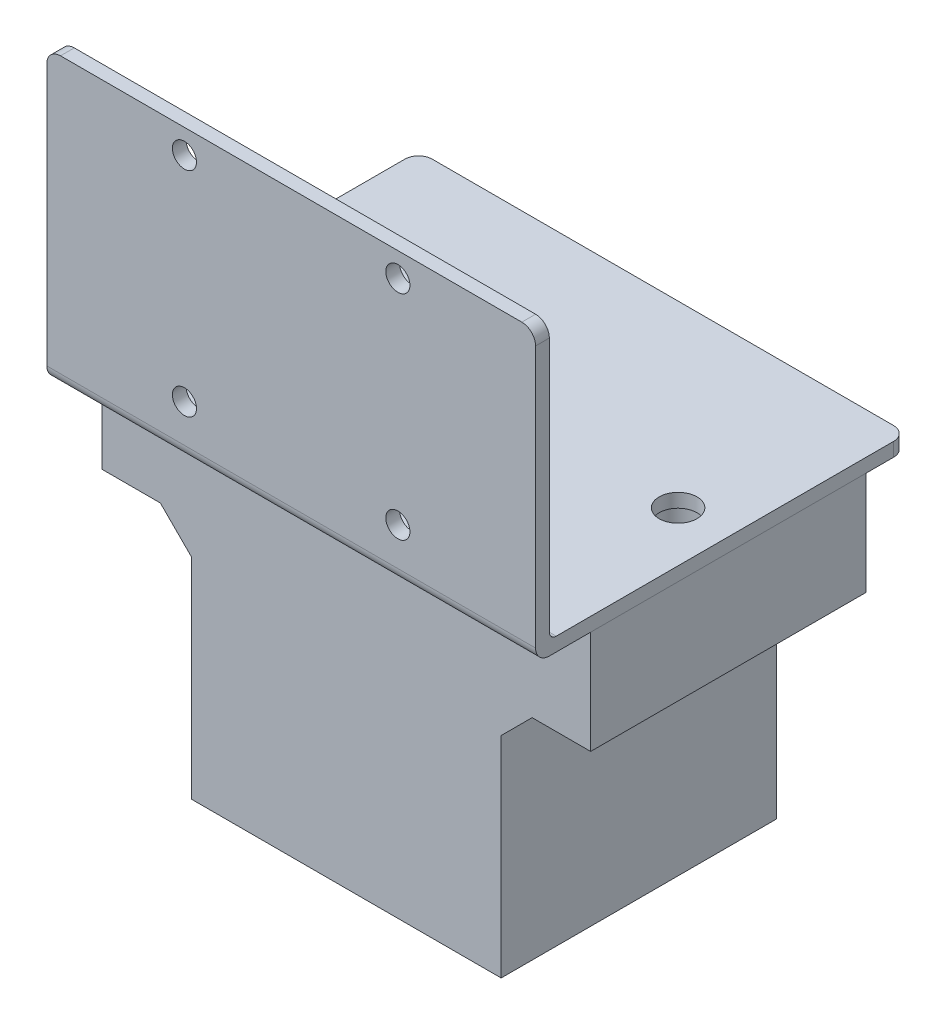
from build123d import *

# Parameters (mm, degrees)
RESSALTO_EXTRUS_O1_DEPTH   = 35.5
CORTE_EXTRUS_O1_DEPTH      = 77.001644719
CORTE_EXTRUS_O1_DEPTH_BACK = 77.001644719
ESBO_O2_R                  = 2.75
FILETE1_R                  = 2
FILETE2_R                  = 1
ESBO_O3_R                  = 1.75
CORTE_EXTRUS_O2_DEPTH      = 76.685203309
ESBO_O4_W                  = 71
ESBO_O4_H                  = 40
ESBO_O4_R                  = 3.25
RESSALTO_EXTRUS_O2_DEPTH   = 15
ESBO_O5_W                  = 45
ESBO_O5_H                  = 40
ESBO_O5_W_2                = 35.75
ESBO_O5_H_2                = 25.25
RESSALTO_EXTRUS_O3_DEPTH   = 35
CHANFRO1_SIZE              = 4.5


with BuildPart() as part:
    # Esboço1 → Ressalto-extrusão1 (new, symmetric)
    with BuildSketch(Plane(origin=(0, 0, 0), x_dir=(0, 0, -1), z_dir=(1, 0, 0))):
        Polygon((0, 0), (0, 42), (2, 42), (2, 2), (54, 2), (54, 0), align=None)
    extrude(amount=RESSALTO_EXTRUS_O1_DEPTH, both=True)

    # Esboço2 → Corte-extrusão1 (cut, two sides: drawn at the far end of the back side and taken through both)
    with BuildSketch(Plane(origin=(0, 2, 0), x_dir=(1, 0, 0), z_dir=(0, 1, 0)).offset(-CORTE_EXTRUS_O1_DEPTH_BACK)):
        with Locations(Location((-27.5, 28, 0), (0, 0, 270))):
            Circle(ESBO_O2_R)
        with Locations(Location((28.2, 28, 0), (0, 0, 270))):
            Circle(ESBO_O2_R)
    extrude(amount=CORTE_EXTRUS_O1_DEPTH + CORTE_EXTRUS_O1_DEPTH_BACK, mode=Mode.SUBTRACT)

    # Filete1
    filete1_edges = [part.edges().sort_by_distance(p)[0] for p in [
        (0, 0, 0),
        (35.5, 42, -1),
        (-35.5, 42, -1),
        (-35.5, 1, -54),
        (35.5, 1, -54),
    ]]
    fillet(filete1_edges, radius=FILETE1_R)

    # Filete2
    filete2_edges = [part.edges().sort_by_distance(p)[0] for p in [
        (0, 2, -2),
    ]]
    fillet(filete2_edges, radius=FILETE2_R)

    # Esboço3 → Corte-extrusão2 (cut, through all)
    with BuildSketch(Plane(origin=(0, 0, -2), x_dir=(-1, 0, 0), z_dir=(0, 0, -1))):
        with Locations(Location((-15.5, 38.5, 0), (0, 0, 90))):
            Circle(ESBO_O3_R)
        with Locations(Location((15.5, 38.5, 0), (0, 0, 90))):
            Circle(ESBO_O3_R)
        with Locations(Location((15.5, 7.5, 0), (0, 0, 90))):
            Circle(ESBO_O3_R)
        with Locations(Location((-15.5, 7.5, 0), (0, 0, 90))):
            Circle(ESBO_O3_R)
    extrude(amount=-CORTE_EXTRUS_O2_DEPTH, mode=Mode.SUBTRACT)


with BuildPart() as body_2:
    # Esboço4 → Ressalto-extrusão2 (new body)
    with BuildSketch(Plane.XZ):
        with Locations((0, -28)):
            Rectangle(ESBO_O4_W, ESBO_O4_H)
        with Locations(Location((-27.5, -28, 0), (0, 0, 270))):
            Circle(ESBO_O4_R, mode=Mode.SUBTRACT)
        with Locations(Location((28.2, -28, 0), (0, 0, 270))):
            Circle(ESBO_O4_R, mode=Mode.SUBTRACT)
    extrude(amount=RESSALTO_EXTRUS_O2_DEPTH)

    # Esboço5 → Ressalto-extrusão3 (add)
    with BuildSketch(Plane.XZ.offset(15)):
        with Locations((0, -28)):
            Rectangle(ESBO_O5_W, ESBO_O5_H)
        with Locations((0, -28)):
            Rectangle(ESBO_O5_W_2, ESBO_O5_H_2, mode=Mode.SUBTRACT)
    extrude(amount=RESSALTO_EXTRUS_O3_DEPTH)

    # Chanfro1
    # the kernel refuses this chamfer: 4.5 mm, written as the material it adds along each edge
    with BuildSketch(Plane(origin=(-22.5, -15, -48), x_dir=(-0.9996219169112966, 0.0274958766105864, 0), z_dir=(0, 0, 1))) as chanfro1_piece_1_section:
        Polygon((CHANFRO1_SIZE * 0.999621916911, CHANFRO1_SIZE * 0.0274958766106), (-CHANFRO1_SIZE * 0.0274958766106, CHANFRO1_SIZE * 0.999621916911), (0, 0), align=None)
    chanfro1_piece_1 = extrude(amount=40, mode=Mode.PRIVATE)
    chanfro1_piece_1 = chanfro1_piece_1 - Plane(origin=(-27.5, -16.515606652, -28), x_dir=(0, 0, -1), z_dir=(0, 1, 0)) * Cylinder(3.25, 98, mode=Mode.PRIVATE)
    add(chanfro1_piece_1)
    with BuildSketch(Plane(origin=(22.5, -15, -8), x_dir=(0.9996219169112966, 0.0274958766105864, 0), z_dir=(0, 0, -1))) as chanfro1_piece_2_section:
        Polygon((CHANFRO1_SIZE * 0.999621916911, CHANFRO1_SIZE * 0.0274958766106), (-CHANFRO1_SIZE * 0.0274958766106, CHANFRO1_SIZE * 0.999621916911), (0, 0), align=None)
    chanfro1_piece_2 = extrude(amount=40, mode=Mode.PRIVATE)
    chanfro1_piece_2 = chanfro1_piece_2 - Plane(origin=(28.2, -16.504829355, -28), x_dir=(0, 0, -1), z_dir=(0, 1, 0)) * Cylinder(3.25, 98, mode=Mode.PRIVATE)
    add(chanfro1_piece_2)


solid = Compound([part.part, body_2.part])
